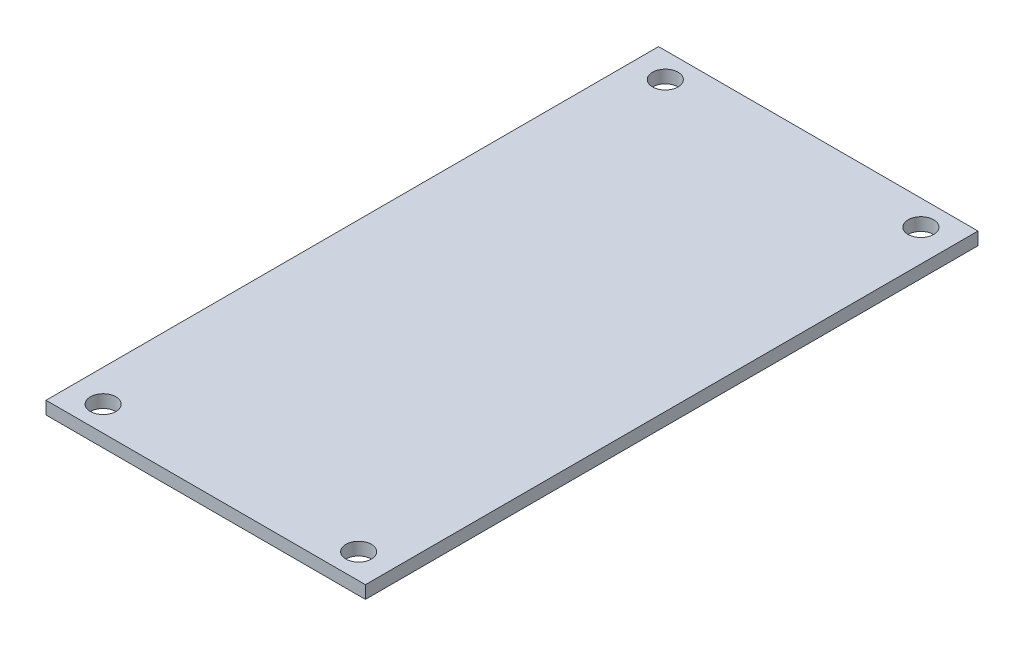
from build123d import *

# Parameters (mm, degrees)
SKETCH1_W           = 125
SKETCH1_H           = 239.7125
BOSS_EXTRUDE1_DEPTH = 5
CUT_EXTRUDE1_REACH  = 272.392
SKETCH2_R           = 5


with BuildPart() as part:
    # Sketch1 → Boss-Extrude1 (new body)
    with BuildSketch(Plane(origin=(0, 0, 0), x_dir=(1, 0, 0), z_dir=(0, 1, 0))):
        with Locations((62.5, -119.85625)):
            Rectangle(SKETCH1_W, SKETCH1_H)
    extrude(amount=BOSS_EXTRUDE1_DEPTH)

    # Sketch2 → Cut-Extrude1 (cut, up to next)
    with BuildSketch(Plane.XZ, mode=Mode.PRIVATE) as cut_extrude1_sk1:
        with Locations((12.5, 229.85625)):
            Circle(SKETCH2_R)
    cut_extrude1_tool1 = extrude(cut_extrude1_sk1.sketch, amount=-CUT_EXTRUDE1_REACH, mode=Mode.PRIVATE) & part.part
    # Sketch2 → Cut-Extrude1 (cut, up to next)
    with BuildSketch(Plane.XZ, mode=Mode.PRIVATE) as cut_extrude1_sk2:
        with Locations((112.5, 229.85625)):
            Circle(SKETCH2_R)
    cut_extrude1_tool2 = extrude(cut_extrude1_sk2.sketch, amount=-CUT_EXTRUDE1_REACH, mode=Mode.PRIVATE) & part.part
    # Sketch2 → Cut-Extrude1 (cut, up to next)
    with BuildSketch(Plane.XZ, mode=Mode.PRIVATE) as cut_extrude1_sk3:
        with Locations((12.5, 9.85625)):
            Circle(SKETCH2_R)
    cut_extrude1_tool3 = extrude(cut_extrude1_sk3.sketch, amount=-CUT_EXTRUDE1_REACH, mode=Mode.PRIVATE) & part.part
    # Sketch2 → Cut-Extrude1 (cut, up to next)
    with BuildSketch(Plane.XZ, mode=Mode.PRIVATE) as cut_extrude1_sk4:
        with Locations((112.5, 9.85625)):
            Circle(SKETCH2_R)
    cut_extrude1_tool4 = extrude(cut_extrude1_sk4.sketch, amount=-CUT_EXTRUDE1_REACH, mode=Mode.PRIVATE) & part.part
    add(cut_extrude1_tool1.solids().sort_by_distance((12.5, 0, 229.85625))[0], mode=Mode.SUBTRACT)
    add(cut_extrude1_tool2.solids().sort_by_distance((112.5, 0, 229.85625))[0], mode=Mode.SUBTRACT)
    add(cut_extrude1_tool3.solids().sort_by_distance((12.5, 0, 9.85625))[0], mode=Mode.SUBTRACT)
    add(cut_extrude1_tool4.solids().sort_by_distance((112.5, 0, 9.85625))[0], mode=Mode.SUBTRACT)


solid = part.part
